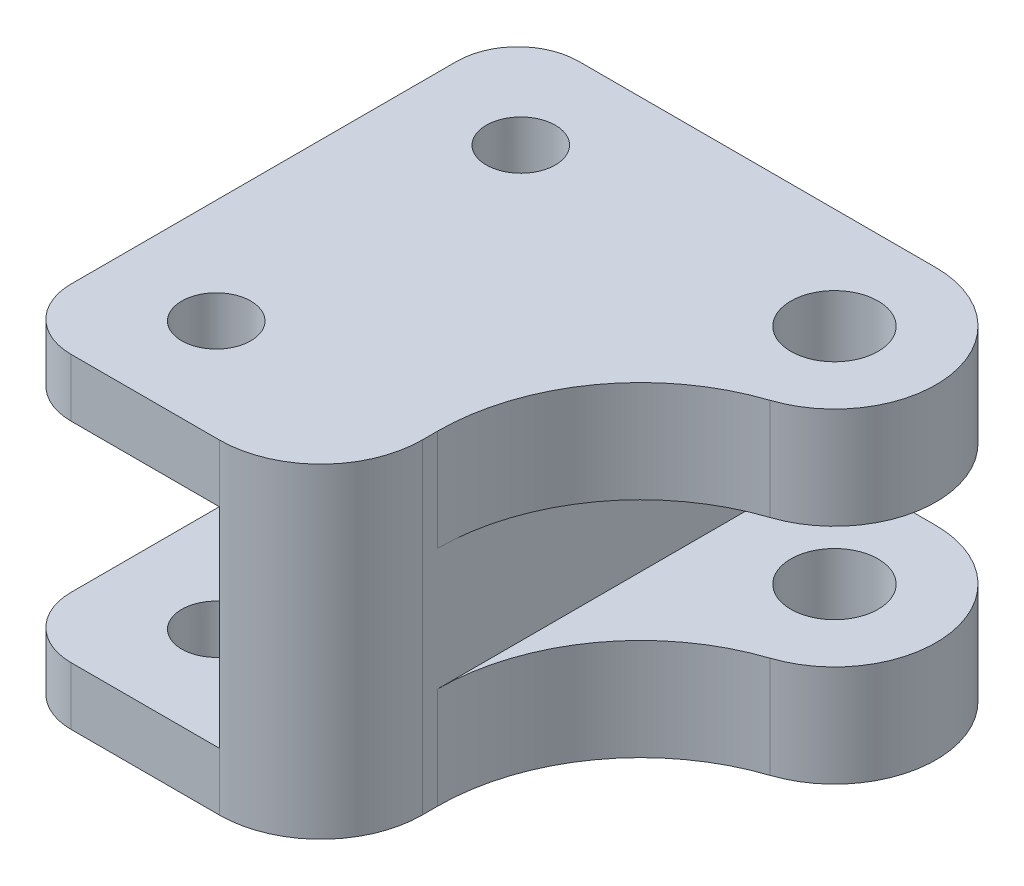
from build123d import *

# Parameters (mm, degrees)
EXTRUDE_1_DEPTH     = 25
SKETCH_2_R          = 1.7
CUT_EXTRUDE_1_DEPTH = 32.369132918
SKETCH_3_R          = 2.15
EXTRUDE_2_DEPTH     = 16
SKETCH_4_W          = 20
SKETCH_4_H          = 6
CUT_EXTRUDE_2_DEPTH = 31.382396219
FILLET_1_R          = 10
FILLET_2_R          = 5
FILLET_3_R          = 3


# Some blends are built 0.0001 mm under size
with BuildPart() as part:
    # ｽｹｯﾁ1 → ﾎﾞｽ - 押し出し1 (new body)
    with BuildSketch(Plane.XY):
        Polygon((5.15, 0), (10.15, 0), (10.15, 8), (-5.15, 8), (-5.15, 5.15), (5.15, 5.15), align=None)
        Polygon((10.15, -8), (10.15, 0), (5.15, 0), (5.15, -5.15), (-5.15, -5.15), (-5.15, -8), align=None)
    extrude(amount=EXTRUDE_1_DEPTH)

    # ｽｹｯﾁ2 → ｶｯﾄ - 押し出し1 (cut, through all)
    with BuildSketch(Plane.XZ.offset(8)):
        with Locations(Location((0, 20, 0), (0, 0, 270))):
            Circle(SKETCH_2_R)
        with Locations(Location((0, 5, 0), (0, 0, 270))):
            Circle(SKETCH_2_R)
    extrude(amount=-CUT_EXTRUDE_1_DEPTH, mode=Mode.SUBTRACT)

    # ｽｹｯﾁ3 → ﾎﾞｽ - 押し出し2 (add, through all)
    with BuildSketch(Plane.XZ.offset(8)):
        with BuildLine():
            Line((10.15, 0), (15.45, 0))
            ThreePointArc((15.45, 0), (20.45, 5), (15.45, 10))
            Line((15.45, 10), (10.15, 10))
            Line((10.15, 10), (10.15, 0))
        make_face()
        with Locations(Location((15.45, 5, 0), (0, 0, 270))):
            Circle(SKETCH_3_R, mode=Mode.SUBTRACT)
    extrude(amount=-EXTRUDE_2_DEPTH)

    # ｽｹｯﾁ4 → ｶｯﾄ - 押し出し2 (cut, through all)
    with BuildSketch(Plane(origin=(10.15, 0, 0), x_dir=(0, 0, -1), z_dir=(1, 0, 0))):
        Rectangle(SKETCH_4_W, SKETCH_4_H)
    extrude(amount=CUT_EXTRUDE_2_DEPTH, mode=Mode.SUBTRACT)

    # ﾌｨﾚｯﾄ1
    # the kernel refuses this fillet: 10 mm, written as the material it adds along each edge
    with BuildSketch(Plane(origin=(10.15, -8, 10), x_dir=(0, 0, 1), z_dir=(0, 1, 0)), Plane(origin=(10.15, 3, 10), x_dir=(0, 0, 1), z_dir=(0, 1, 0))) as fillet_1_piece_1:
        with BuildLine():
            CenterArc((9.244648118, 10), FILLET_1_R, 198.260227933, 71.739772067)
            Line((-0.251783961, 6.866666667), (-1.201427169, 6.553333333))
            ThreePointArc((-1.201427169, 6.553333333), (-1, 5.3), (-1, 0))
            Line((-1, 0), (0, -1))
            Line((0, -1), (9.244648118, -1))
            Line((9.244648118, -1), (9.244648118, 0))
        make_face()
    extrude(amount=5)
    with BuildSketch(Plane(origin=(10.15, -8, 10), x_dir=(0, 0, 1), z_dir=(0, 1, 0))) as fillet_1_piece_2_section:
        with BuildLine():
            CenterArc((9.244648118, 10), FILLET_1_R, 198.260227933, 71.739772067)
            Line((-0.251783961, 6.866666667), (-1.201427169, 6.553333333))
            ThreePointArc((-1.201427169, 6.553333333), (-1, 5.3), (-1, 0))
            Line((-1, 0), (0, -1))
            Line((0, -1), (9.244648118, -1))
            Line((9.244648118, -1), (9.244648118, 0))
        make_face()
    fillet_1_piece_2 = extrude(amount=28.111620295, mode=Mode.PRIVATE)
    fillet_1_piece_2 = split(fillet_1_piece_2, bisect_by=Plane(origin=(11.517519747, 8, 12.315903655), z_dir=(0, -1, 0)), keep=Keep.TOP, mode=Mode.PRIVATE)
    fillet_1_piece_2 = split(fillet_1_piece_2, bisect_by=Plane(origin=(11.517519747, 3, 12.315903655), z_dir=(0, 1, 0)), keep=Keep.TOP, mode=Mode.PRIVATE)
    add(fillet_1_piece_2)
    with BuildSketch(Plane(origin=(10.15, -20.111620295, 10), x_dir=(0, 0, 1), z_dir=(0, 1, 0))) as fillet_1_piece_3_section:
        with BuildLine():
            CenterArc((9.244648118, 10), FILLET_1_R, 198.260227933, 71.739772067)
            Line((-0.251783961, 6.866666667), (-1.201427169, 6.553333333))
            ThreePointArc((-1.201427169, 6.553333333), (-1, 5.3), (-1, 0))
            Line((-1, 0), (0, -1))
            Line((0, -1), (9.244648118, -1))
            Line((9.244648118, -1), (9.244648118, 0))
        make_face()
    fillet_1_piece_3 = extrude(amount=28.111620295, mode=Mode.PRIVATE)
    fillet_1_piece_3 = split(fillet_1_piece_3, bisect_by=Plane(origin=(11.517519747, -8, 12.315903655), z_dir=(0, 1, 0)), keep=Keep.TOP, mode=Mode.PRIVATE)
    fillet_1_piece_3 = split(fillet_1_piece_3, bisect_by=Plane(origin=(11.517519747, -3, 12.315903655), z_dir=(0, -1, 0)), keep=Keep.TOP, mode=Mode.PRIVATE)
    add(fillet_1_piece_3)

    # ﾌｨﾚｯﾄ2
    fillet_2_edges = [part.edges().sort_by_distance(p)[0] for p in [
        (10.15, 0, 25),
    ]]
    fillet(fillet_2_edges, radius=FILLET_2_R - 0.0001)  # a hair under: the kernel refuses the full size

    # ﾌｨﾚｯﾄ3
    fillet_3_edges = [part.edges().sort_by_distance(p)[0] for p in [
        (-5.15, 6.575, 0),
        (-5.15, -6.575, 0),
        (-5.15, -6.575, 25),
        (-5.15, 6.575, 25),
    ]]
    fillet(fillet_3_edges, radius=FILLET_3_R)


solid = part.part
